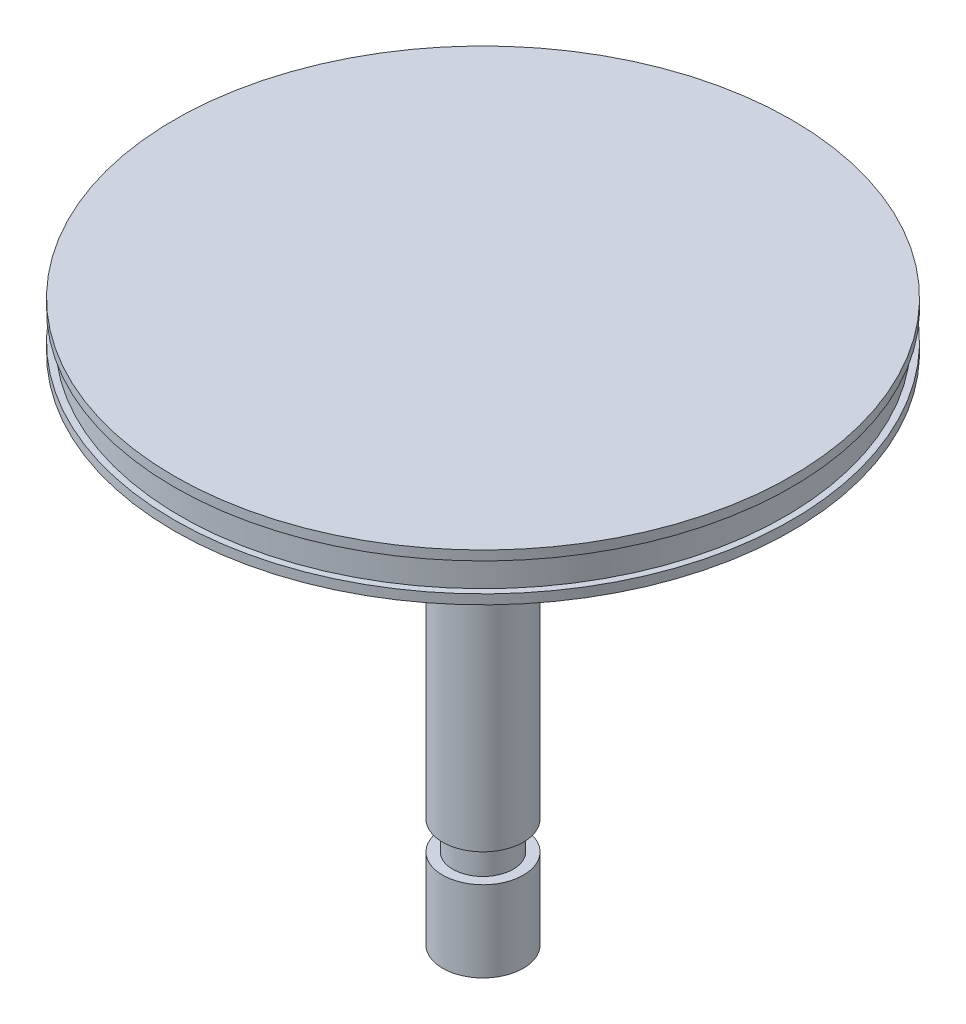
from build123d import *

# Parameters (mm, degrees)
SKETCH2_R           = 63.66
BOSS_EXTRUDE1_DEPTH = 5
SKETCH3_R           = 65
BOSS_EXTRUDE2_DEPTH = 2
SKETCH4_R           = 6.366
BOSS_EXTRUDE3_DEPTH = 108
SKETCH5_R           = 8.5
BOSS_EXTRUDE4_DEPTH = 17
SKETCH6_R           = 10
BOSS_EXTRUDE5_DEPTH = 2
BOSS_EXTRUDE6_START = 17
SKETCH7_R           = 8.5
BOSS_EXTRUDE6_DEPTH = 17
SKETCH8_R           = 8.5
BOSS_EXTRUDE7_DEPTH = 30


with BuildPart() as part:
    # Sketch2 → Boss-Extrude1 (new, symmetric)
    with BuildSketch(Plane(origin=(0, 0, 0), x_dir=(1, 0, 0), z_dir=(0, 1, 0))):
        Circle(SKETCH2_R)
    extrude(amount=BOSS_EXTRUDE1_DEPTH, both=True)

    # Sketch3 → Boss-Extrude2 (add)
    with BuildSketch(Plane.XZ.offset(5)):
        Circle(SKETCH3_R)
    boss_extrude2 = extrude(amount=-BOSS_EXTRUDE2_DEPTH)

    # Mirror1: Boss-Extrude2 across plane
    add(boss_extrude2.mirror(Plane.ZX))

    # Sketch4 → Boss-Extrude3 (add)
    with BuildSketch(Plane.XZ.offset(5)):
        Circle(SKETCH4_R)
    extrude(amount=BOSS_EXTRUDE3_DEPTH)

    # Sketch5 → Boss-Extrude4 (add)
    with BuildSketch(Plane.XZ.offset(113)):
        Circle(SKETCH5_R)
    extrude(amount=-BOSS_EXTRUDE4_DEPTH)

    # Sketch6 → Boss-Extrude5 (add)
    with BuildSketch(Plane.XZ.offset(5)):
        Circle(SKETCH6_R)
    extrude(amount=BOSS_EXTRUDE5_DEPTH)

    # Sketch7 → Boss-Extrude6 (add)
    with BuildSketch(Plane.XZ.offset(7).offset(BOSS_EXTRUDE6_START)):
        Circle(SKETCH7_R)
    extrude(amount=-BOSS_EXTRUDE6_DEPTH)

    # Sketch8 → Boss-Extrude7 (add, symmetric)
    with BuildSketch(Plane(origin=(0, -60, 0), x_dir=(-1, 0, 0), z_dir=(0, -1, 0))):
        Circle(SKETCH8_R)
    extrude(amount=BOSS_EXTRUDE7_DEPTH, both=True)


solid = part.part
